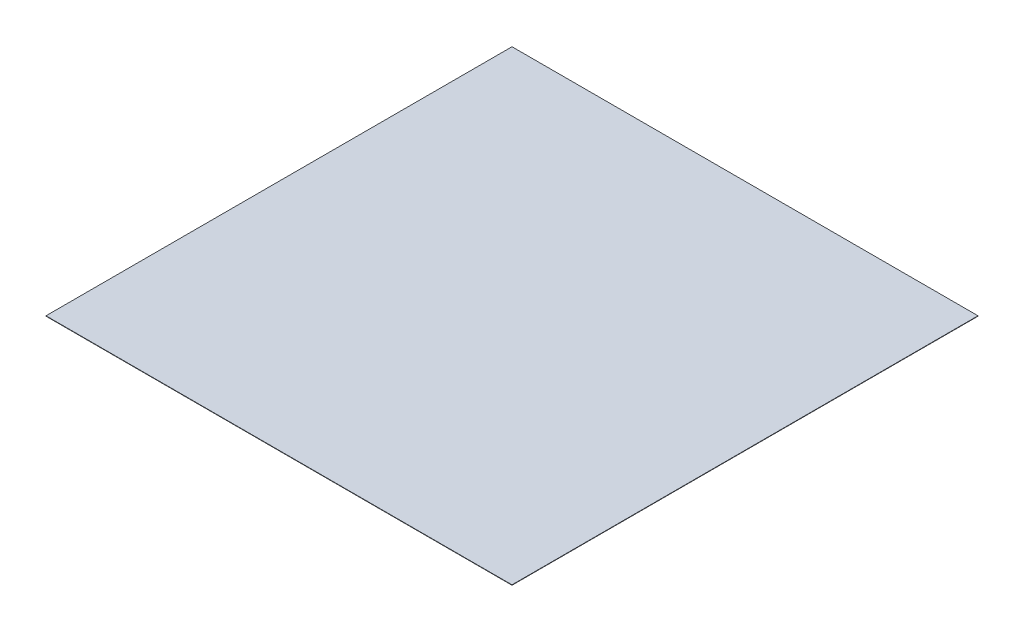
from build123d import *

# Parameters (mm, degrees)
BOSS_EXTRUDE1_DEPTH = 20
BOSS_EXTRUDE2_START = -5
SKETCH3_W           = 26.197224363
SKETCH3_H           = 40
SKETCH3_R           = 1.5
SKETCH3_W_2         = 30.197224362
BOSS_EXTRUDE2_DEPTH = 5
SKETCH4_W           = 1200
SKETCH4_H           = 1200
BOSS_EXTRUDE3_DEPTH = 1


with BuildPart() as part:
    # Sketch2 → Boss-Extrude1 (new body)
    with BuildSketch(Plane(origin=(0, 0, 134.88320255), x_dir=(-1, 0, 0), z_dir=(0, 0, -1))):
        with BuildLine():
            Line((-8.010113394, 153.56443927), (-27.207337757, 153.56443927))
            ThreePointArc((-27.207337757, 153.56443927), (-25.963827563, 152.287849446), (-25.510113394, 150.56443927))
            Line((-25.510113394, 150.56443927), (-25.510113394, 146.56443927))
            ThreePointArc((-25.510113394, 146.56443927), (-24.777880347, 144.796672317), (-23.010113394, 144.06443927))
            Line((-23.010113394, 144.06443927), (-19.010113394, 144.06443927))
            ThreePointArc((-19.010113394, 144.06443927), (-16.53523966, 143.039313005), (-15.510113394, 140.56443927))
            Line((-15.510113394, 140.56443927), (-15.510113394, 106.56443927))
            ThreePointArc((-15.510113394, 106.56443927), (-16.53523966, 104.089565536), (-19.010113394, 103.06443927))
            Line((-19.010113394, 103.06443927), (-23.010113394, 103.06443927))
            ThreePointArc((-23.010113394, 103.06443927), (-24.777880347, 102.332206223), (-25.510113394, 100.56443927))
            Line((-25.510113394, 100.56443927), (-25.510113394, 96.56443927))
            ThreePointArc((-25.510113394, 96.56443927), (-26.53523966, 94.089565536), (-29.010113394, 93.06443927))
            Line((-29.010113394, 93.06443927), (-63.010113394, 93.06443927))
            ThreePointArc((-63.010113394, 93.06443927), (-65.484987129, 94.089565536), (-66.510113394, 96.56443927))
            Line((-66.510113394, 96.56443927), (-66.510113394, 100.56443927))
            ThreePointArc((-66.510113394, 100.56443927), (-67.242346441, 102.332206223), (-69.010113394, 103.06443927))
            Line((-69.010113394, 103.06443927), (-73.010113394, 103.06443927))
            ThreePointArc((-73.010113394, 103.06443927), (-75.484987129, 104.089565536), (-76.510113394, 106.56443927))
            Line((-76.510113394, 106.56443927), (-76.510113394, 140.56443927))
            ThreePointArc((-76.510113394, 140.56443927), (-75.484987129, 143.039313005), (-73.010113394, 144.06443927))
            Line((-73.010113394, 144.06443927), (-69.010113394, 144.06443927))
            ThreePointArc((-69.010113394, 144.06443927), (-67.242346441, 144.796672317), (-66.510113394, 146.56443927))
            Line((-66.510113394, 146.56443927), (-66.510113394, 150.56443927))
            ThreePointArc((-66.510113394, 150.56443927), (-66.056399226, 152.287849446), (-64.812889032, 153.56443927))
            Line((-64.812889032, 153.56443927), (-84.010113394, 153.56443927))
            Line((-84.010113394, 153.56443927), (-84.010113394, 140.56443927))
            Line((-84.010113394, 140.56443927), (-84.010113394, 106.56443927))
            ThreePointArc((-84.010113394, 106.56443927), (-81.119985899, 99.13275252), (-73.968301038, 95.606251627))
            ThreePointArc((-73.968301038, 95.606251627), (-70.441800145, 88.454566766), (-63.010113394, 85.56443927))
            Line((-63.010113394, 85.56443927), (-29.010113394, 85.56443927))
            ThreePointArc((-29.010113394, 85.56443927), (-21.578426644, 88.454566766), (-18.051925751, 95.606251627))
            ThreePointArc((-18.051925751, 95.606251627), (-10.90024089, 99.13275252), (-8.010113394, 106.56443927))
            Line((-8.010113394, 106.56443927), (-8.010113394, 140.56443927))
            Line((-8.010113394, 140.56443927), (-8.010113394, 153.56443927))
        make_face()
    extrude(amount=BOSS_EXTRUDE1_DEPTH)

    # Sketch3 → Boss-Extrude2 (add)
    # profile 1 of 2: a face of its own
    with BuildSketch(Plane(origin=(0, 153.56443927, 0), x_dir=(1, 0, 0), z_dir=(0, 1, 0)).offset(BOSS_EXTRUDE2_START)):
        with Locations((11.108725576, -124.88320255)):
            Rectangle(SKETCH3_W, SKETCH3_H)
        with Locations((3.010113394, -139.88320255)):
            Circle(SKETCH3_R, mode=Mode.SUBTRACT)
        with Locations((3.010113394, -109.88320255)):
            Circle(SKETCH3_R, mode=Mode.SUBTRACT)
    # profile 2 of 2: a face of its own
    with BuildSketch(Plane(origin=(0, 153.56443927, 0), x_dir=(1, 0, 0), z_dir=(0, 1, 0)).offset(BOSS_EXTRUDE2_START)):
        with Locations((82.911501213, -124.88320255)):
            Rectangle(SKETCH3_W_2, SKETCH3_H)
        with Locations((93.010113394, -109.88320255)):
            Circle(SKETCH3_R, mode=Mode.SUBTRACT)
        with Locations((93.010113394, -139.88320255)):
            Circle(SKETCH3_R, mode=Mode.SUBTRACT)
    extrude(amount=BOSS_EXTRUDE2_DEPTH)


with BuildPart() as body_2:
    # Sketch4 → Boss-Extrude3 (new body)
    with BuildSketch(Plane(origin=(0, 223.56443927, 0), x_dir=(1, 0, 0), z_dir=(0, 1, 0))):
        Rectangle(SKETCH4_W, SKETCH4_H)
    extrude(amount=BOSS_EXTRUDE3_DEPTH)


solid = Compound([part.part, body_2.part])
